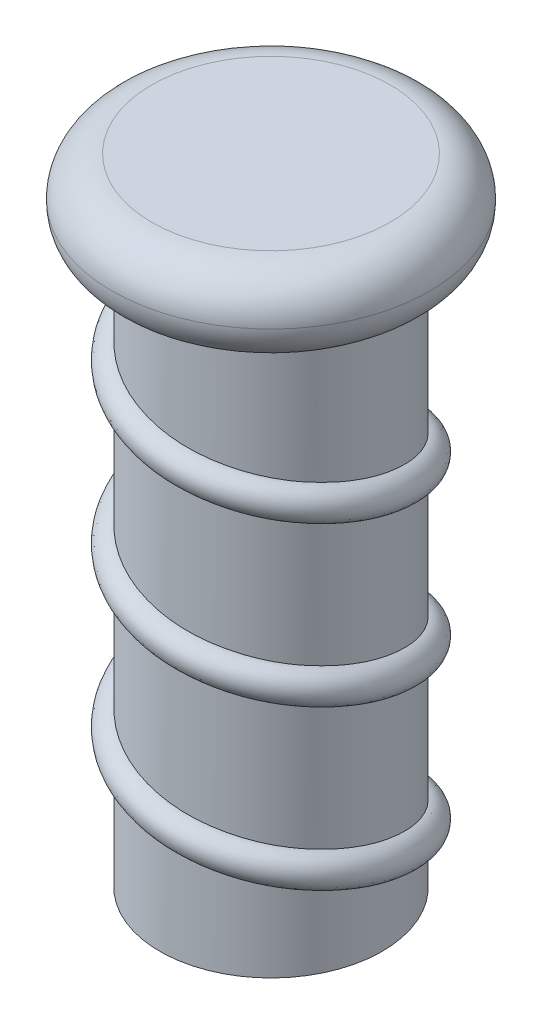
from build123d import *

# Parameters (mm, degrees)
SKETCH1_R           = 1.4
BOSS_EXTRUDE1_DEPTH = 7
SKETCH2_R           = 2
BOSS_EXTRUDE2_DEPTH = 1
FILLET3_R           = 0.5
SWEEP1_PITCH        = 2
SWEEP1_HEIGHT       = 6.5
SWEEP1_RADIUS       = 1.4
SWEEP1_START_ANGLE  = -90
SWEEP1_PROFILE_R    = 0.2


with BuildPart() as part:
    # Sketch1 → Boss-Extrude1 (new body)
    with BuildSketch(Plane(origin=(0, 0, 0), x_dir=(1, 0, 0), z_dir=(0, 1, 0))):
        with Locations(Location((0, 0, 0), (0, 0, 270))):
            Circle(SKETCH1_R)
    extrude(amount=BOSS_EXTRUDE1_DEPTH)

    # Sketch2 → Boss-Extrude2 (add)
    with BuildSketch(Plane(origin=(0, 7, 0), x_dir=(1, 0, 0), z_dir=(0, 1, 0))):
        with Locations(Location((0, 0, 0), (0, 0, 270))):
            Circle(SKETCH2_R)
    extrude(amount=BOSS_EXTRUDE2_DEPTH)

    # Fillet3
    fillet3_edges = [part.edges().sort_by_distance(p)[0] for p in [
        (0, 7, -2),
        (0, 8, -2),
    ]]
    fillet(fillet3_edges, radius=FILLET3_R - 0.0001)  # a hair under: the kernel refuses the full size

    # Sweep1: sweep along a helix
    with BuildLine() as sweep1_path:
        add(Helix(SWEEP1_PITCH, SWEEP1_HEIGHT, SWEEP1_RADIUS, center=(0, 0, 0), direction=(0, 1, 0), lefthand=True, mode=Mode.PRIVATE).rotate(Axis((0, 0, 0), (0, 1, 0)), SWEEP1_START_ANGLE))
    # Sweep1 profile (on start of the path) → Sweep1 (sweep)
    with BuildSketch(Plane(origin=(-1.4, 0, 0), x_dir=(0, -0.9751135749579573, -0.22170592218682939), z_dir=(-2.894606634846599e-14, 0.22170592218682939, -0.9751135749579573))):
        Circle(SWEEP1_PROFILE_R)
    sweep(path=sweep1_path.line, is_frenet=True)


solid = part.part
